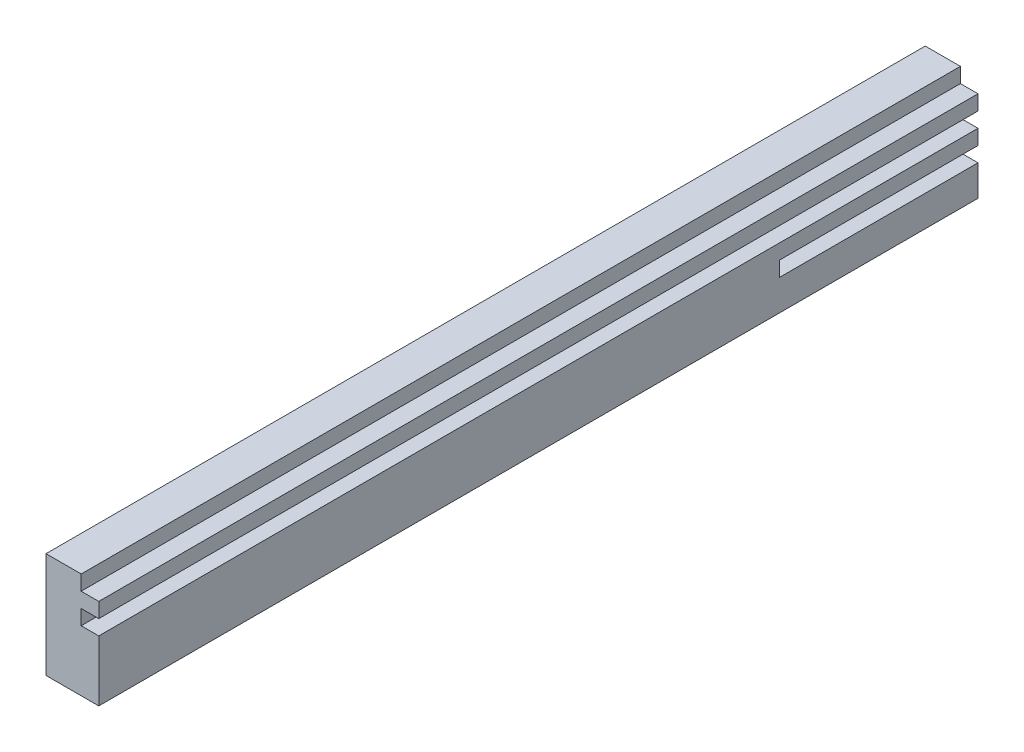
from build123d import *

# Parameters (mm, degrees)
SKETCH1_W           = 500
SKETCH1_H           = 60
BOSS_EXTRUDE1_DEPTH = 30
SKETCH2_W           = 500
SKETCH2_H           = 8.5
SKETCH2_W_2         = 112.888451377
CUT_EXTRUDE1_DEPTH  = 10


with BuildPart() as part:
    # Sketch1 → Boss-Extrude1 (new body)
    with BuildSketch(Plane(origin=(0, 0, 0), x_dir=(0, 0, -1), z_dir=(1, 0, 0))):
        with Locations((250, 30)):
            Rectangle(SKETCH1_W, SKETCH1_H)
    extrude(amount=BOSS_EXTRUDE1_DEPTH)

    # Sketch2 → Cut-Extrude1 (cut)
    with BuildSketch(Plane(origin=(30, 0, 0), x_dir=(0, 0, -1), z_dir=(1, 0, 0))):
        with Locations((250, 55.75)):
            Rectangle(SKETCH2_W, SKETCH2_H)
        with Locations((250, 38.75)):
            Rectangle(SKETCH2_W, SKETCH2_H)
        with Locations((443.555774312, 21.75)):
            Rectangle(SKETCH2_W_2, SKETCH2_H)
    extrude(amount=-CUT_EXTRUDE1_DEPTH, mode=Mode.SUBTRACT)


solid = part.part
